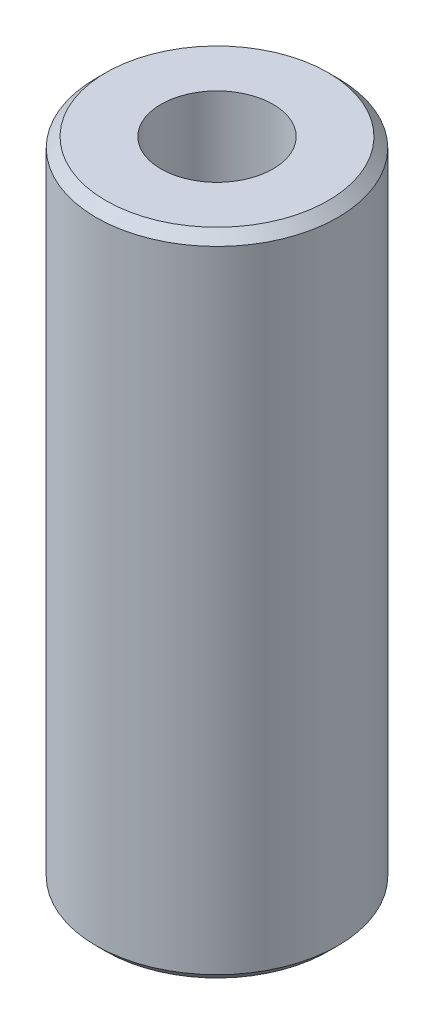
from build123d import *

# Parameters (mm, degrees)
SKETCH1_R           = 57.5
BOSS_EXTRUDE1_DEPTH = 309.584803723
SKETCH2_R           = 26.684978638
CUT_EXTRUDE1_DEPTH  = 321.086317571
CHAMFER1_SIZE       = 4.638590598


with BuildPart() as part:
    # Sketch1 → Boss-Extrude1 (new body)
    with BuildSketch(Plane(origin=(0, 0, 0), x_dir=(1, 0, 0), z_dir=(0, 1, 0))):
        Circle(SKETCH1_R)
    extrude(amount=BOSS_EXTRUDE1_DEPTH)

    # Sketch2 → Cut-Extrude1 (cut, through all)
    with BuildSketch(Plane(origin=(0, 0, 0), x_dir=(1, 0, 0), z_dir=(0, 1, 0))):
        Circle(SKETCH2_R)
    extrude(amount=CUT_EXTRUDE1_DEPTH, mode=Mode.SUBTRACT)

    # Chamfer1
    chamfer1_edges = [part.edges().sort_by_distance(p)[0] for p in [
        (-57.5, 309.584803723, 0),
        (-57.5, 0, 0),
    ]]
    chamfer(chamfer1_edges, length=CHAMFER1_SIZE)


solid = part.part
